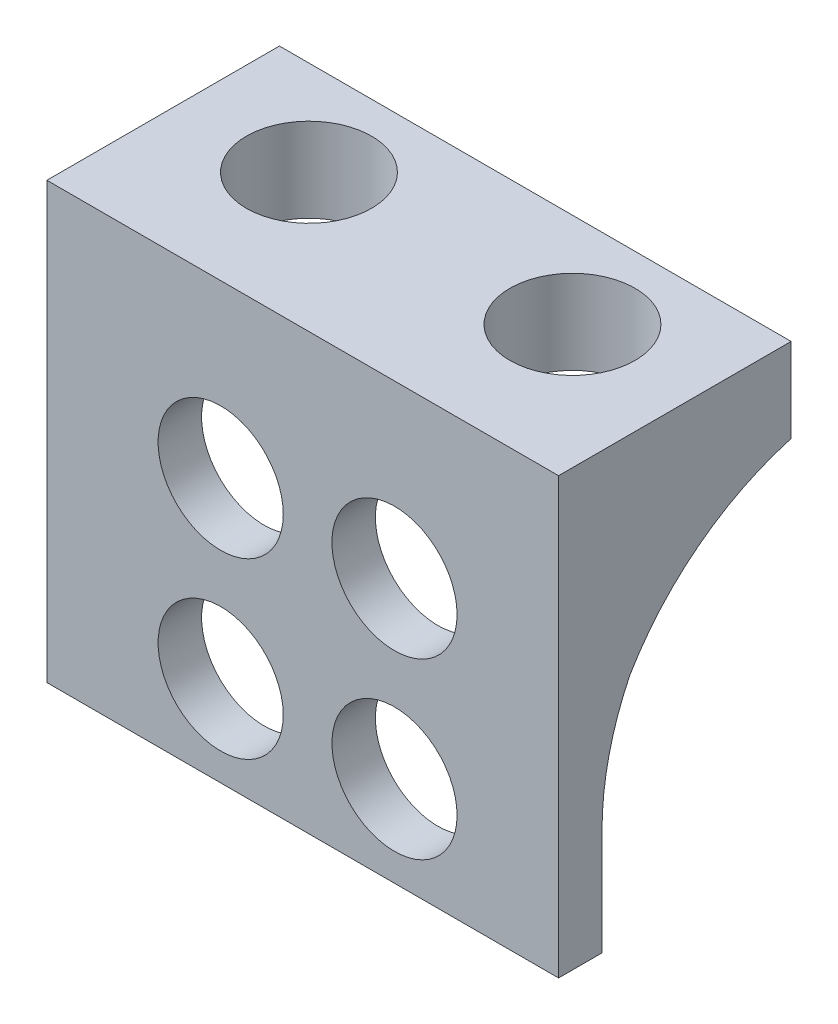
from build123d import *

# Parameters (mm, degrees)
SKETCH1_W           = 18.6944
SKETCH1_H           = 6.9088
BOSS_EXTRUDE1_DEPTH = 3.0734
SKETCH2_R           = 2.286
CUT_EXTRUDE1_DEPTH  = 3.0734
SKETCH3_W           = 18.6944
SKETCH3_H           = 15.893108249
SKETCH3_R           = 2.286
BOSS_EXTRUDE3_DEPTH = 1.5875
BOSS_EXTRUDE4_DEPTH = 1.5875
BOSS_EXTRUDE5_DEPTH = 1.5875
FILLET1_R           = 10


with BuildPart() as part:
    # Sketch1 → Boss-Extrude1 (new body)
    with BuildSketch(Plane(origin=(0, 0, 0), x_dir=(1, 0, 0), z_dir=(0, 1, 0))):
        with Locations((9.3472, -3.4544)):
            Rectangle(SKETCH1_W, SKETCH1_H)
    extrude(amount=BOSS_EXTRUDE1_DEPTH)

    # Sketch2 → Cut-Extrude1 (cut)
    with BuildSketch(Plane(origin=(0, 3.0734, 0), x_dir=(1, 0, 0), z_dir=(0, 1, 0))):
        with Locations(Location((4.5339, -3.4544, 0), (0, 0, 270))):
            Circle(SKETCH2_R)
        with Locations(Location((14.1605, -3.4544, 0), (0, 0, 270))):
            Circle(SKETCH2_R)
    extrude(amount=-CUT_EXTRUDE1_DEPTH, mode=Mode.SUBTRACT)

    # Sketch3 → Boss-Extrude3 (add)
    with BuildSketch(Plane.XY.offset(6.9088)):
        with Locations((9.3472, -4.873154125)):
            Rectangle(SKETCH3_W, SKETCH3_H)
        with Locations((12.7, -9.525)):
            Circle(SKETCH3_R, mode=Mode.SUBTRACT)
        with Locations((6.35, -9.525)):
            Circle(SKETCH3_R, mode=Mode.SUBTRACT)
        with Locations((12.7, -3.175)):
            Circle(SKETCH3_R, mode=Mode.SUBTRACT)
        with Locations((6.35, -3.175)):
            Circle(SKETCH3_R, mode=Mode.SUBTRACT)
    extrude(amount=BOSS_EXTRUDE3_DEPTH)

    # Sketch4 → Boss-Extrude4 (add)
    with BuildSketch(Plane.ZY):
        Polygon((3.4544, 0), (6.9088, -6.409854124), (6.9088, 0), align=None)
    extrude(amount=-BOSS_EXTRUDE4_DEPTH)

    # Sketch5 → Boss-Extrude5 (add)
    with BuildSketch(Plane(origin=(18.6944, 0, 0), x_dir=(0, 0, -1), z_dir=(1, 0, 0))):
        Polygon((-3.4544, 0), (-6.9088, -6.409854124), (-6.9088, 0), align=None)
    extrude(amount=-BOSS_EXTRUDE5_DEPTH)

    # Fillet1
    # the kernel refuses this fillet: 10 mm, written as the material it adds along each edge
    with BuildSketch(Plane(origin=(0, -6.409854124, 6.9088), x_dir=(0, 0.8803024942448967, -0.4744128145678757), z_dir=(1, 0, 0)), Plane(origin=(18.6944, -6.409854124, 6.9088), x_dir=(0, -1, 0), z_dir=(-1, 0, 0))) as fillet1_piece_1:
        with BuildLine():
            CenterArc((FILLET1_R * 0.252306645351, -FILLET1_R), FILLET1_R, 90, 28.321125328)
            Line((-FILLET1_R * 0.222106169217, -FILLET1_R * 0.119697505755), (-FILLET1_R * 0.231594425508, -FILLET1_R * 0.10209145587))
            Line((-FILLET1_R * 0.231594425508, -FILLET1_R * 0.10209145587), (-FILLET1_R * 0.00504613290702, FILLET1_R * 0.02))
            Line((-FILLET1_R * 0.00504613290702, FILLET1_R * 0.02), (FILLET1_R * 0.252306645351, FILLET1_R * 0.02))
            Line((FILLET1_R * 0.252306645351, FILLET1_R * 0.02), (FILLET1_R * 0.252306645351, 0))
        make_face()
    extrude(amount=1.5875)
    with BuildSketch(Plane(origin=(0, 0, 3.4544), x_dir=(0, 0, -1), z_dir=(1, 0, 0))) as fillet1_piece_2:
        with BuildLine():
            CenterArc((6.173594354, -9.623200199), FILLET1_R, 105.778516421, 45.90035825)
            Line((-2.629430588, -4.879072053), (-2.805491087, -4.78418949))
            Line((-2.805491087, -4.78418949), (-0.176060499, 0.094882563))
            Line((-0.176060499, 0.094882563), (0, 0.2))
            ThreePointArc((0, 0.2), (1.7272, 0.2), (3.400016113, 0.192464004))
            Line((3.400016113, 0.192464004), (3.4544, 0))
        make_face()
    extrude(amount=1.5875)
    with BuildSketch(Plane(origin=(18.6944, 0, 3.4544), x_dir=(0, 0, -1), z_dir=(-1, 0, 0))) as fillet1_piece_3:
        with BuildLine():
            CenterArc((6.173594354, 9.623200199), FILLET1_R, 208.321125328, 45.90035825)
            Line((-2.629430588, 4.879072053), (-2.805491087, 4.78418949))
            Line((-2.805491087, 4.78418949), (-0.176060499, -0.094882563))
            Line((-0.176060499, -0.094882563), (0, -0.2))
            ThreePointArc((0, -0.2), (1.7272, -0.2), (3.400016113, -0.192464004))
            Line((3.400016113, -0.192464004), (3.4544, 0))
        make_face()
    extrude(amount=1.5875)


solid = part.part
